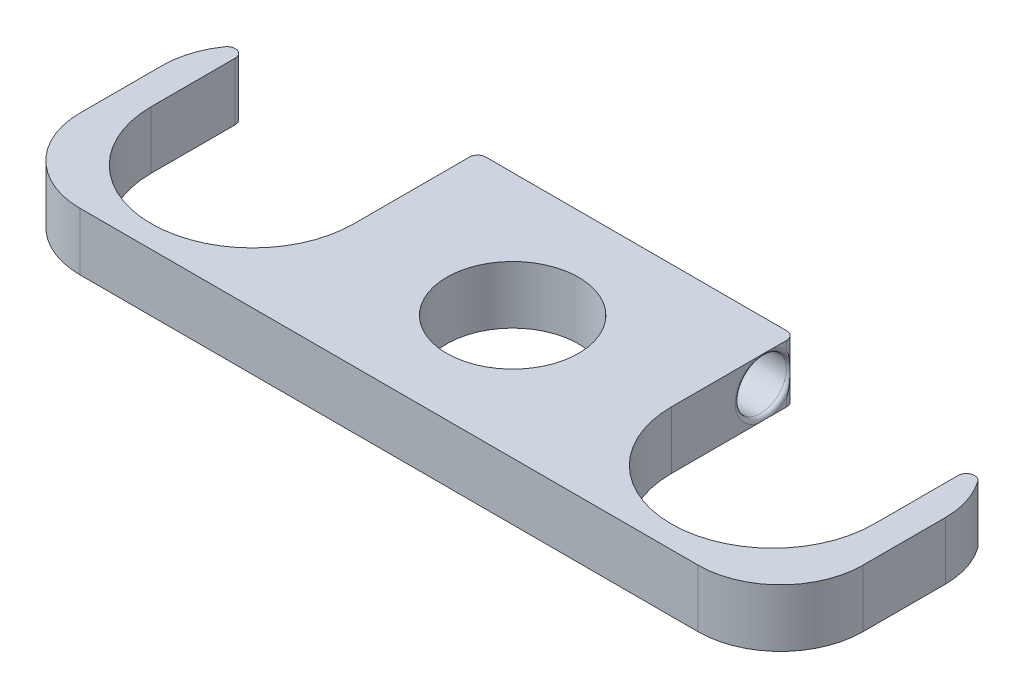
from build123d import *

# Parameters (mm, degrees)
SKETCH1_R           = 8
BOSS_EXTRUDE1_DEPTH = 7
CUT_EXTRUDE1_DEPTH  = 10
SKETCH3_R           = 3.1
CUT_EXTRUDE2_DEPTH  = 6
FILLET1_R           = 0.5
FILLET2_R           = 1
FILLET3_R           = 1
FILLET5_R           = 1
FILLET6_R           = 0.5
FILLET7_R           = 1


with BuildPart() as part:
    # Sketch1 → Boss-Extrude1 (new body)
    with BuildSketch(Plane(origin=(0, 0, 0), x_dir=(1, 0, 0), z_dir=(0, 1, 0))):
        with BuildLine():
            Line((-37.5, -15), (37.5, -15))
            ThreePointArc((37.5, -15), (44.571067812, -12.071067812), (47.5, -5))
            Line((47.5, -5), (47.5, 5))
            ThreePointArc((47.5, 5), (44.571067812, 12.071067812), (37.5, 15))
            Line((37.5, 15), (-37.5, 15))
            ThreePointArc((-37.5, 15), (-44.571067812, 12.071067812), (-47.5, 5))
            Line((-47.5, 5), (-47.5, -5))
            ThreePointArc((-47.5, -5), (-44.571067812, -12.071067812), (-37.5, -15))
        make_face()
        with Locations(Location((0, 0, 0), (0, 0, 270))):
            Circle(SKETCH1_R, mode=Mode.SUBTRACT)
    extrude(amount=BOSS_EXTRUDE1_DEPTH)

    # Sketch2 → Cut-Extrude1 (cut)
    with BuildSketch(Plane(origin=(0, 7, 0), x_dir=(1, 0, 0), z_dir=(0, 1, 0))):
        with BuildLine():
            Line((-19.25, 0), (-19.25, 15))
            Line((-19.25, 15), (-43.85, 15))
            Line((-43.85, 15), (-43.85, 0))
            ThreePointArc((-43.85, 0), (-31.55, -12.3), (-19.25, 0))
        make_face()
    cut_extrude1 = extrude(amount=-CUT_EXTRUDE1_DEPTH, mode=Mode.SUBTRACT)

    # Sketch3 → Cut-Extrude2 (cut)
    with BuildSketch(Plane.ZY.offset(19.25)):
        with Locations((-11.34873736, 3.5)):
            Circle(SKETCH3_R)
    cut_extrude2 = extrude(amount=-CUT_EXTRUDE2_DEPTH, mode=Mode.SUBTRACT)

    # Fillet1
    # the kernel refuses this fillet: 0.5 mm, written as the material it takes off along each edge
    with BuildSketch(Plane(origin=(-19.25, 3.5, -11.34873736), x_dir=(0, 0, 1), z_dir=(0, -1, 0))) as fillet1_piece_1:
        with BuildLine():
            CenterArc((3.1 + FILLET1_R, -FILLET1_R), FILLET1_R, 90, 90)
            Line((3.1, -FILLET1_R), (3.1, 0))
            Line((3.1, 0), (3.1 + FILLET1_R, 0))
        make_face()
    revolve(axis=Axis((-19.25, 3.5, -11.34873736), (-1, 0, 0)), mode=Mode.SUBTRACT)

    # Fillet2
    fillet2_edges = [part.edges().sort_by_distance(p)[0] for p in [
        (-43.85, 3.5, -12.725121358),
    ]]
    fillet(fillet2_edges, radius=FILLET2_R)

    # Fillet3
    # the kernel refuses this fillet: 1 mm, written as the material it takes off along each edge
    with BuildSketch(Plane(origin=(-19.25, 9.5, -15), x_dir=(0, 0, 1), z_dir=(0, -1, 0))) as fillet3_piece_1:
        with BuildLine():
            CenterArc((FILLET3_R, -FILLET3_R), FILLET3_R, 90, 90)
            Line((0, -FILLET3_R), (-FILLET3_R * 0.02, -FILLET3_R))
            Line((-FILLET3_R * 0.02, -FILLET3_R), (-FILLET3_R * 0.02, FILLET3_R * 0.02))
            Line((-FILLET3_R * 0.02, FILLET3_R * 0.02), (FILLET3_R, FILLET3_R * 0.02))
            Line((FILLET3_R, FILLET3_R * 0.02), (FILLET3_R, 0))
        make_face()
    extrude(amount=12, mode=Mode.SUBTRACT)

    # Mirror5: Cut-Extrude1, Cut-Extrude2 across plane
    add(cut_extrude1.mirror(Plane.ZY), mode=Mode.SUBTRACT)
    add(cut_extrude2.mirror(Plane.ZY), mode=Mode.SUBTRACT)

    # Fillet5
    fillet5_edges = [part.edges().sort_by_distance(p)[0] for p in [
        (43.85, 3.5, -12.725121358),
    ]]
    fillet(fillet5_edges, radius=FILLET5_R)

    # Fillet6
    # the kernel refuses this fillet: 0.5 mm, written as the material it takes off along each edge
    with BuildSketch(Plane(origin=(19.25, 3.5, -11.34873736), x_dir=(0, 0, 1), z_dir=(0, -1, 0))) as fillet6_piece_1:
        with BuildLine():
            CenterArc((3.1 + FILLET6_R, FILLET6_R), FILLET6_R, 180, 90)
            Line((3.1, FILLET6_R), (3.1, 0))
            Line((3.1, 0), (3.1 + FILLET6_R, 0))
        make_face()
    revolve(axis=Axis((19.25, 3.5, -11.34873736), (-1, 0, 0)), mode=Mode.SUBTRACT)

    # Fillet7
    # the kernel refuses this fillet: 1 mm, written as the material it takes off along each edge
    with BuildSketch(Plane(origin=(19.25, 9.5, -15), x_dir=(-1, 0, 0), z_dir=(0, -1, 0))) as fillet7_piece_1:
        with BuildLine():
            CenterArc((FILLET7_R, -FILLET7_R), FILLET7_R, 90, 90)
            Line((0, -FILLET7_R), (-FILLET7_R * 0.02, -FILLET7_R))
            Line((-FILLET7_R * 0.02, -FILLET7_R), (-FILLET7_R * 0.02, FILLET7_R * 0.02))
            Line((-FILLET7_R * 0.02, FILLET7_R * 0.02), (FILLET7_R, FILLET7_R * 0.02))
            Line((FILLET7_R, FILLET7_R * 0.02), (FILLET7_R, 0))
        make_face()
    extrude(amount=12, mode=Mode.SUBTRACT)


solid = part.part
